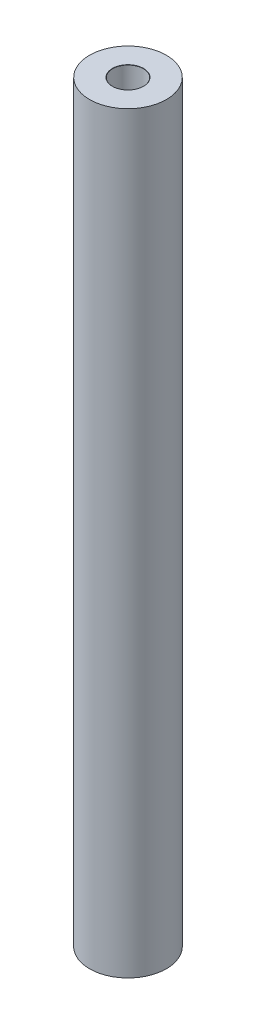
from build123d import *

# Parameters (mm, degrees)
SKETCH1_R           = 5
BOSS_EXTRUDE1_DEPTH = 98


with BuildPart() as part:
    # Sketch1 → Boss-Extrude1 (new body)
    with BuildSketch(Plane(origin=(0, 0, 0), x_dir=(1, 0, 0), z_dir=(0, 1, 0))):
        Circle(SKETCH1_R)
    extrude(amount=BOSS_EXTRUDE1_DEPTH)

    # Sketch4 → Ø4.0mm Dowel Hole1 (revolve, cut)
    with BuildSketch(Plane(origin=(0, 98, 0), x_dir=(0, 0, 1), z_dir=(1, 0, 0))):
        Polygon((0, 0), (0, 14.201721238), (2, 13), (2, 0.025), (2.025, 0), align=None)
    f_4_0mm_dowel_hole1 = revolve(axis=Axis((0, 104.35, 0), (0, -1, 0)), mode=Mode.SUBTRACT)

    # Mirror1: Ø4.0mm Dowel Hole1 across plane
    add(f_4_0mm_dowel_hole1.mirror(Plane.ZX.offset(49)), mode=Mode.SUBTRACT)


solid = part.part
